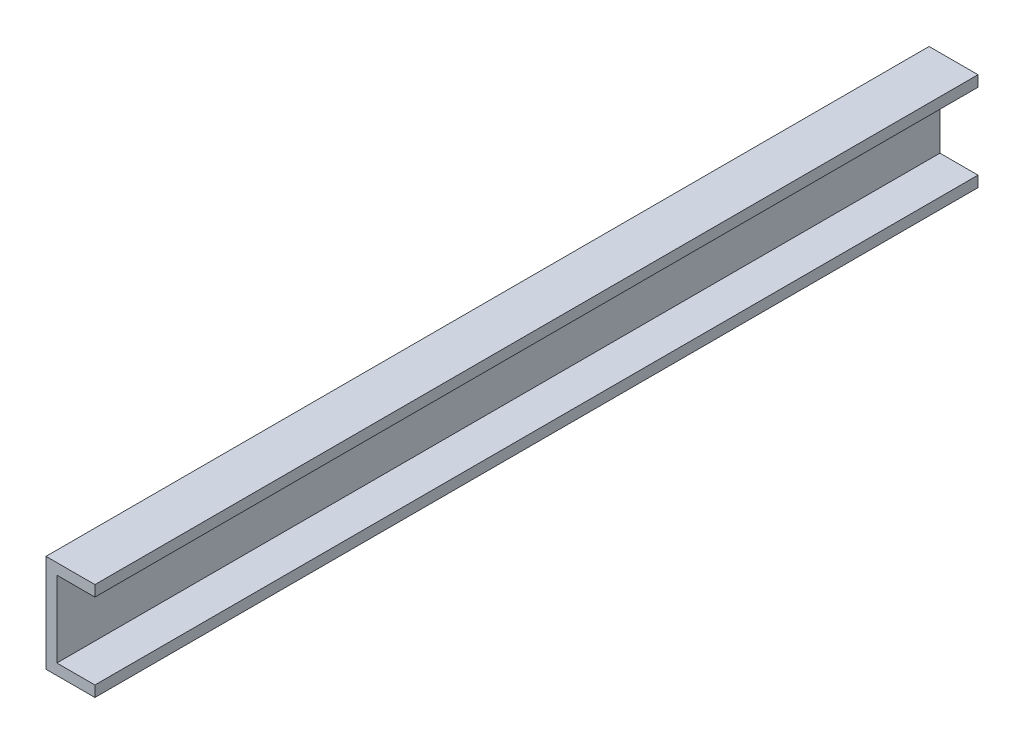
from build123d import *

# Parameters (mm, degrees)
BOSS_EXTRUDE1_DEPTH = 162.5


with BuildPart() as part:
    # Sketch1 → Boss-Extrude1 (new body)
    with BuildSketch(Plane.XY):
        Polygon((0, 9), (0, -9), (9, -9), (9, -7), (2, -7), (2, 7), (9, 7), (9, 9), align=None)
    extrude(amount=-BOSS_EXTRUDE1_DEPTH)


solid = part.part
